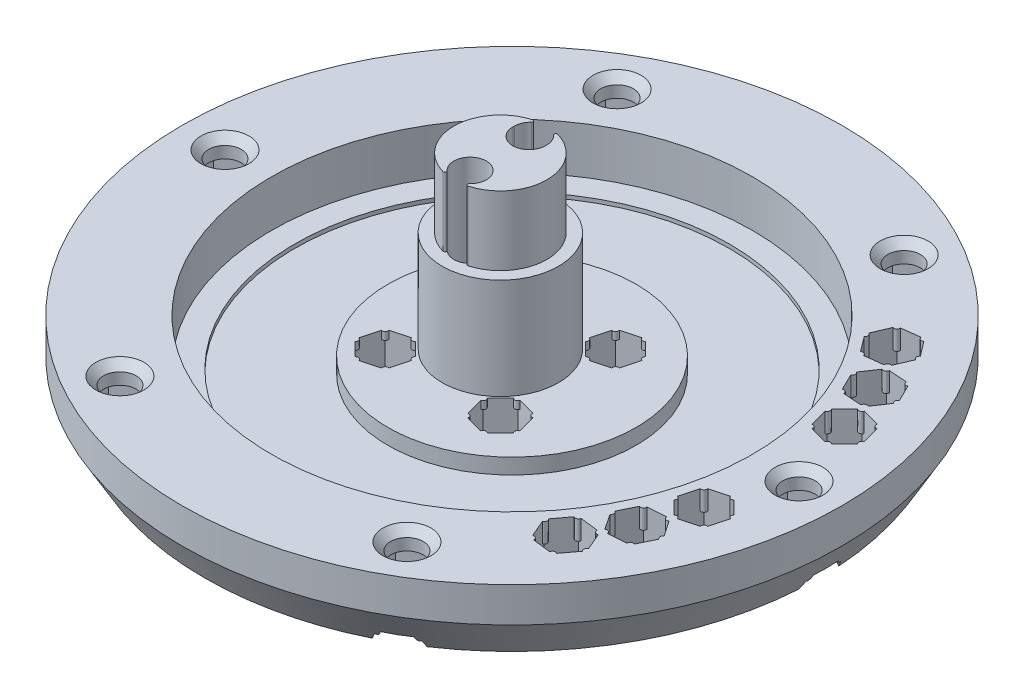
from build123d import *

# Parameters (mm, degrees)
SKETCH18_R              = 2.1
CUT_EXTRUDE11_DEPTH     = 79.825757212
CUT_EXTRUDE12_DEPTH     = 7
SKETCH20_R              = 0.4
BOSS_EXTRUDE1_DEPTH     = 2.5
CIRPATTERN1_COUNT       = 6
CHAMFER5_SIZE           = 1
SKETCH6_R               = 1.6
CUT_EXTRUDE1_DEPTH      = 76.686854869
CUT_EXTRUDE3_DEPTH      = 4.5
SKETCH17_R              = 3
CUT_EXTRUDE10_DEPTH     = 7
SKETCH28_R              = 0.4
BOSS_EXTRUDE4_DEPTH     = 1
CUT_EXTRUDE6_REACH      = 70.567
SKETCH12_R              = 2.1
CUT_EXTRUDE5_DEPTH      = 85.926438757
SPLIT1_SURFACE_1_BACK   = 135.35
SPLIT1_SURFACE_1_DEPTH  = 270.7
SPLIT1_SURFACE_2_BACK   = 135.35
SPLIT1_SURFACE_2_DEPTH  = 270.7
SKETCH14_R              = 3.7
CUT_EXTRUDE7_DEPTH      = 4
CUT_EXTRUDE16_DEPTH     = 83.149254409
MOVE_START              = 27
MOVE_FACE1_DEPTH        = 14.5
MOVE_START_2            = 26.9
MOVE_FACE2_DEPTH        = 0.1
CHAMFER1_SIZE           = 5
CHAMFER1_SIZE_2         = 2.886751346
CHAMFER2_SIZE           = 0.699461487
CHAMFER2_SIZE_2         = 1.5
CHAMFER3_SIZE           = 1
CHAMFER3_SIZE_2         = 0.577350269
CUT_EXTRUDE8_DEPTH      = 13
SKETCH26_R              = 0.3
BOSS_EXTRUDE3_DEPTH     = 8.5
SKETCH21_R              = 1.6
CUT_EXTRUDE13_DEPTH     = 79.825757384
CUT_EXTRUDE14_DEPTH     = 5.5
SKETCH23_R              = 0.4
BOSS_EXTRUDE2_DEPTH     = 2.5
SKETCH24_R              = 3
CUT_EXTRUDE15_DEPTH     = 3
CIRPATTERN2_COUNT       = 3
CIRPATTERN2_ANGLE       = 22
MIRROR1_COPY_1_SKETCH_R = 1.6
MIRROR1_COPY_1_DEPTH    = 79.825757384
MIRROR1_COPY_2_SKETCH_R = 1.6
MIRROR1_COPY_2_DEPTH    = 79.825757384
MIRROR1_COPY_3_DEPTH    = 5.5
MIRROR1_COPY_4_DEPTH    = 5.5
MIRROR1_COPY_5_SKETCH_R = 0.4
MIRROR1_COPY_5_DEPTH    = 2.5
MIRROR1_COPY_6_SKETCH_R = 0.4
MIRROR1_COPY_6_DEPTH    = 2.5
MIRROR1_COPY_7_SKETCH_R = 3
MIRROR1_COPY_7_DEPTH    = 3
MIRROR1_COPY_8_SKETCH_R = 3
MIRROR1_COPY_8_DEPTH    = 3
CUT_EXTRUDE17_DEPTH     = 5
BOSS_EXTRUDE5_START     = 0.5
SKETCH30_R              = 2
BOSS_EXTRUDE5_DEPTH     = 4.5
SKETCH16_R              = 3.16
CUT_EXTRUDE9_DEPTH      = 3.3


# Read off the part's stored shape, not the designer's step: Move Face1, Move Face2
with BuildPart() as part:
    # Sketch1 → Revolve1 (revolve)
    with BuildSketch(Plane.XY, mode=Mode.PRIVATE) as revolve1_sk:
        Polygon((0, 0), (-42.5, 0), (-42.5, 9.5), (-31, 9.5), (-31, 3.5), (-28, 3.5), (-28, 3), (-16, 3), (-16, 5), (0, 5), align=None)
    revolve(revolve1_sk.sketch.rotate(Axis((0, 0, 0), (0, 1, 0)), 270), axis=Axis((0, 0, 0), (0, 1, 0)))

    # Sketch2 → Revolve2 (revolve)
    with BuildSketch(Plane.XY, mode=Mode.PRIVATE) as revolve2_sk:
        Polygon((0, -9), (-15, -9), (-15, -1), (-18, -1), (-18, 0), (0, 0), align=None)
        Polygon((0, 51), (-8.5, 51), (-8.5, 43), (-10.5, 43), (-10.5, 41.5), (0, 41.5), align=None)
    revolve(revolve2_sk.sketch.rotate(Axis((0, 0, 0), (0, 1, 0)), 270), axis=Axis((0, 0, 0), (0, 1, 0)))


with BuildPart() as revolve2_piece_1:
    # of the separate pieces the step leaves, piece 1, a body of its own (revolve2_pieces)
    add(part.part.solids().sort_by_distance((0, 0, -42.5))[0])



with BuildPart() as revolve2_piece_2:
    # of the separate pieces the step leaves, piece 2, a body of its own (revolve2_pieces)
    add(part.part.solids().sort_by_distance((0, 51, -8.5))[0])


with BuildPart() as revolve2_piece_1_1:
    add(revolve2_piece_1.part)

    add(revolve2_piece_2.part)  # Revolve3 merges Revolve2 piece 2
    # Sketch3 → Revolve3 (revolve)
    with BuildSketch(Plane.XY):
        Polygon((-1.5, 5), (-9, 5), (-9, 18), (-7.5, 18), (-7.5, 40.5), (-9, 40.5), (-9, 43), (-7.5, 43), (-1.5, 43), align=None)
    revolve(axis=Axis((-1.5, 57.896768885, 0), (0, -1, 0)))

    # Sketch18 → Cut-Extrude11 (cut, through all)
    with BuildSketch(Plane.XZ):
        with Locations(Location((-37, 0, 0), (0, 0, 270))):
            Circle(SKETCH18_R)
        with Locations(Location((-18.5, 32.04293994, 0), (0, 0, 270))):
            Circle(SKETCH18_R)
        with Locations(Location((18.5, 32.04293994, 0), (0, 0, 270))):
            Circle(SKETCH18_R)
        with Locations(Location((37, 0, 0), (0, 0, 270))):
            Circle(SKETCH18_R)
        with Locations(Location((18.5, -32.04293994, 0), (0, 0, 270))):
            Circle(SKETCH18_R)
        with Locations(Location((-18.5, -32.04293994, 0), (0, 0, 270))):
            Circle(SKETCH18_R)
    extrude(amount=-CUT_EXTRUDE11_DEPTH, mode=Mode.SUBTRACT)

    # Sketch19 → Cut-Extrude12 (cut)
    with BuildSketch(Plane.XZ):
        Polygon((-33.5, -2.020725942), (-33.5, 2.020725942), (-37, 4.041451884), (-40.5, 2.020725942), (-40.5, -2.020725942), (-37, -4.041451884), align=None)
    cut_extrude12 = extrude(amount=-CUT_EXTRUDE12_DEPTH, mode=Mode.SUBTRACT)

    # Sketch20 → Boss-Extrude1 (add)
    with BuildSketch(Plane.XZ):
        with Locations((-40.5, 2.020725942)):
            Circle(SKETCH20_R)
        with Locations((-37, 4.041451884)):
            Circle(SKETCH20_R)
        with Locations((-33.5, 2.020725942)):
            Circle(SKETCH20_R)
        with Locations((-33.5, -2.020725942)):
            Circle(SKETCH20_R)
        with Locations((-37, -4.041451884)):
            Circle(SKETCH20_R)
        with Locations((-40.5, -2.020725942)):
            Circle(SKETCH20_R)
    boss_extrude1 = extrude(amount=-BOSS_EXTRUDE1_DEPTH)

    # CirPattern1: Cut-Extrude12, Boss-Extrude1 ×6 about axis
    cirpattern1_axis = Axis((0, 0, 0), (0, 1, 0))
    add([cut_extrude12.rotate(cirpattern1_axis, i * 360 / CIRPATTERN1_COUNT) for i in range(1, CIRPATTERN1_COUNT)], mode=Mode.SUBTRACT)
    add([boss_extrude1.rotate(cirpattern1_axis, i * 360 / CIRPATTERN1_COUNT) for i in range(1, CIRPATTERN1_COUNT)])

    # Chamfer5
    chamfer5_edges = [revolve2_piece_1_1.edges().sort_by_distance(p)[0] for p in [
        (-37, 9.5, 2.1),
        (-18.5, 9.5, -29.94293994),
        (18.5, 9.5, -29.94293994),
        (37, 9.5, 2.1),
        (18.5, 9.5, 34.14293994),
        (-18.5, 9.5, 34.14293994),
    ]]
    chamfer(chamfer5_edges, length=CHAMFER5_SIZE)

    # Sketch6 → Cut-Extrude1 (cut, through all)
    with BuildSketch(Plane(origin=(0, 5, 0), x_dir=(1, 0, 0), z_dir=(0, 1, 0))):
        with Locations(Location((5.924621202, 7.424621202, 0), (0, 0, 270))):
            Circle(SKETCH6_R)
        with Locations(Location((5.924621202, -7.424621202, 0), (0, 0, 270))):
            Circle(SKETCH6_R)
        with Locations(Location((-8.924621202, -7.424621202, 0), (0, 0, 270))):
            Circle(SKETCH6_R)
        with Locations(Location((-8.924621202, 7.424621202, 0), (0, 0, 270))):
            Circle(SKETCH6_R)
    extrude(amount=-CUT_EXTRUDE1_DEPTH, mode=Mode.SUBTRACT)

    # Sketch10 → Cut-Extrude3 (cut)
    with BuildSketch(Plane(origin=(0, 5, 0), x_dir=(1, 0, 0), z_dir=(0, 1, 0))):
        Polygon((6.746482052, 10.491847649), (3.679255605, 9.6699868), (2.857394755, 6.602760353), (5.102760353, 4.357394755), (8.1699868, 5.179255605), (8.991847649, 8.246482052), align=None)
        Polygon((8.991847649, -8.246482052), (8.1699868, -5.179255605), (5.102760353, -4.357394755), (2.857394755, -6.602760353), (3.679255605, -9.6699868), (6.746482052, -10.491847649), align=None)
        Polygon((-9.746482052, -10.491847649), (-6.679255605, -9.6699868), (-5.857394755, -6.602760353), (-8.102760353, -4.357394755), (-11.1699868, -5.179255605), (-11.991847649, -8.246482052), align=None)
        Polygon((-11.991847649, 8.246482052), (-11.1699868, 5.179255605), (-8.102760353, 4.357394755), (-5.857394755, 6.602760353), (-6.679255605, 9.6699868), (-9.746482052, 10.491847649), align=None)
    extrude(amount=-CUT_EXTRUDE3_DEPTH, mode=Mode.SUBTRACT)

    # Sketch17 → Cut-Extrude10 (cut)
    with BuildSketch(Plane.XZ.offset(9)):
        with Locations(Location((5.924621202, -7.424621202, 0), (0, 0, 270))):
            Circle(SKETCH17_R)
        with Locations(Location((-8.924621202, -7.424621202, 0), (0, 0, 270))):
            Circle(SKETCH17_R)
        with Locations(Location((-8.924621202, 7.424621202, 0), (0, 0, 270))):
            Circle(SKETCH17_R)
        with Locations(Location((5.924621202, 7.424621202, 0), (0, 0, 270))):
            Circle(SKETCH17_R)
    extrude(amount=-CUT_EXTRUDE10_DEPTH, mode=Mode.SUBTRACT)

    # Sketch28 → Boss-Extrude4 (add)
    with BuildSketch(Plane(origin=(0, 5, 0), x_dir=(1, 0, 0), z_dir=(0, 1, 0))):
        with Locations((-6.679255605, 9.6699868)):
            Circle(SKETCH28_R)
        with Locations((-5.857394755, 6.602760353)):
            Circle(SKETCH28_R)
        with Locations((-8.102760353, 4.357394755)):
            Circle(SKETCH28_R)
        with Locations((-11.1699868, 5.179255605)):
            Circle(SKETCH28_R)
        with Locations((-11.991847649, 8.246482052)):
            Circle(SKETCH28_R)
        with Locations((-9.746482052, 10.491847649)):
            Circle(SKETCH28_R)
        with Locations((8.1699868, 5.179255605)):
            Circle(SKETCH28_R)
        with Locations((5.102760353, 4.357394755)):
            Circle(SKETCH28_R)
        with Locations((2.857394755, 6.602760353)):
            Circle(SKETCH28_R)
        with Locations((3.679255605, 9.6699868)):
            Circle(SKETCH28_R)
        with Locations((6.746482052, 10.491847649)):
            Circle(SKETCH28_R)
        with Locations((8.991847649, 8.246482052)):
            Circle(SKETCH28_R)
        with Locations((3.679255605, -9.6699868)):
            Circle(SKETCH28_R)
        with Locations((2.857394755, -6.602760353)):
            Circle(SKETCH28_R)
        with Locations((5.102760353, -4.357394755)):
            Circle(SKETCH28_R)
        with Locations((8.1699868, -5.179255605)):
            Circle(SKETCH28_R)
        with Locations((8.991847649, -8.246482052)):
            Circle(SKETCH28_R)
        with Locations((6.746482052, -10.491847649)):
            Circle(SKETCH28_R)
        with Locations((-11.1699868, -5.179255605)):
            Circle(SKETCH28_R)
        with Locations((-8.102760353, -4.357394755)):
            Circle(SKETCH28_R)
        with Locations((-5.857394755, -6.602760353)):
            Circle(SKETCH28_R)
        with Locations((-6.679255605, -9.6699868)):
            Circle(SKETCH28_R)
        with Locations((-9.746482052, -10.491847649)):
            Circle(SKETCH28_R)
        with Locations((-11.991847649, -8.246482052)):
            Circle(SKETCH28_R)
    extrude(amount=-BOSS_EXTRUDE4_DEPTH)

    # Cut-Extrude6: up to this face of the body (flat: up to its plane)
    cut_extrude6_end = Plane(revolve2_piece_1_1.part.faces().sort_by_distance((0, 41.5, 10.203015152))[0])
    # Sketch13 → Cut-Extrude6 (cut, up to the picked face)
    with BuildSketch(Plane(origin=(0, 18, 0), x_dir=(1, 0, 0), z_dir=(0, 1, 0)), mode=Mode.PRIVATE) as cut_extrude6_sk1:
        with BuildLine():
            Line((-2.929743003, 5.43812709), (-0.070256997, 5.43812709))
            ThreePointArc((-0.070256997, 5.43812709), (-0.108528873, 5.682449056), (0.119905865, 5.777188329))
            ThreePointArc((0.119905865, 5.777188329), (-1.5, 6), (-3.119905865, 5.777188329))
            ThreePointArc((-3.119905865, 5.777188329), (-2.891471127, 5.682449056), (-2.929743003, 5.43812709))
        make_face()
    cut_extrude6_tool1 = split(extrude(cut_extrude6_sk1.sketch, amount=CUT_EXTRUDE6_REACH, mode=Mode.PRIVATE), bisect_by=cut_extrude6_end, keep=Keep.BOTH, mode=Mode.PRIVATE)
    # Sketch13 → Cut-Extrude6 (cut, up to the picked face)
    with BuildSketch(Plane(origin=(0, 18, 0), x_dir=(1, 0, 0), z_dir=(0, 1, 0)), mode=Mode.PRIVATE) as cut_extrude6_sk2:
        with BuildLine():
            Line((-2.929743003, -5.43812709), (-0.070256997, -5.43812709))
            ThreePointArc((-0.070256997, -5.43812709), (-0.108528873, -5.682449056), (0.119905865, -5.777188329))
            ThreePointArc((0.119905865, -5.777188329), (-1.5, -6), (-3.119905865, -5.777188329))
            ThreePointArc((-3.119905865, -5.777188329), (-2.891471127, -5.682449056), (-2.929743003, -5.43812709))
        make_face()
    cut_extrude6_tool2 = split(extrude(cut_extrude6_sk2.sketch, amount=CUT_EXTRUDE6_REACH, mode=Mode.PRIVATE), bisect_by=cut_extrude6_end, keep=Keep.BOTH, mode=Mode.PRIVATE)
    add(cut_extrude6_tool1.solids().sort_by(Axis((-1.5, 18, -5.69578), (0, 1, 0)))[0], mode=Mode.SUBTRACT)
    add(cut_extrude6_tool2.solids().sort_by(Axis((-1.5, 18, 5.69578), (0, 1, 0)))[0], mode=Mode.SUBTRACT)

    # Sketch12 → Cut-Extrude5 (cut, through all)
    with BuildSketch(Plane(origin=(0, 51, 0), x_dir=(1, 0, 0), z_dir=(0, 1, 0))):
        with Locations(Location((-1.5, -3.9, 0), (0, 0, 90))):
            Circle(SKETCH12_R)
        with BuildLine():
            Line((0.6, 3.9), (0.6, 3.7))
            ThreePointArc((0.6, 3.7), (-1.5, 1.6), (-3.6, 3.7))
            Line((-3.6, 3.7), (-3.6, 3.9))
            ThreePointArc((-3.6, 3.9), (-1.5, 6), (0.6, 3.9))
        make_face()
    extrude(amount=-CUT_EXTRUDE5_DEPTH, mode=Mode.SUBTRACT)


with BuildPart() as body_2:
    # Split1: the piece behind the surface
    add(revolve2_piece_1_1.part)
    # Split1 surface: a surface, the sketch's curves swept straight by 270.7 mm
    with BuildLine(Plane.ZY.offset(-SPLIT1_SURFACE_1_BACK), mode=Mode.PRIVATE) as split1_surface_1_path:
        Line((-8.5, 27), (-2, 27))
        Line((-2, 27), (2, 27))
        Line((2, 27), (8.5, 27))
    split1_surface_1 = Shell.extrude(split1_surface_1_path.wire(), (-1 * SPLIT1_SURFACE_1_DEPTH, 0 * SPLIT1_SURFACE_1_DEPTH, 0 * SPLIT1_SURFACE_1_DEPTH))
    split(bisect_by=split1_surface_1, keep=Keep.BOTTOM)

    # Move Face2 outline → Move Face2 (cut)
    with BuildSketch(Plane(origin=(0, 0, 0), x_dir=(1, 0, 0), z_dir=(0, 1, 0)).offset(MOVE_START_2)):
        with BuildLine():
            ThreePointArc((-2.929743003, 5.43812709), (-2.891471127, 5.682449056), (-3.119905865, 5.777188329))
            ThreePointArc((-3.119905865, 5.777188329), (-7.5, 0), (-3.119905865, -5.777188329))
            ThreePointArc((-3.119905865, -5.777188329), (-2.891471127, -5.682449056), (-2.929743003, -5.43812709))
            ThreePointArc((-2.929743003, -5.43812709), (-1.5, -1.8), (-0.070256997, -5.43812709))
            ThreePointArc((-0.070256997, -5.43812709), (-0.108528873, -5.682449056), (0.119905865, -5.777188329))
            ThreePointArc((0.119905865, -5.777188329), (4.5, 0), (0.119905865, 5.777188329))
            ThreePointArc((0.119905865, 5.777188329), (-0.108528873, 5.682449056), (-0.070256997, 5.43812709))
            ThreePointArc((-0.070256997, 5.43812709), (0.425157176, 4.738909916), (0.6, 3.9))
            Line((0.6, 3.9), (0.6, 3.7))
            ThreePointArc((0.6, 3.7), (-1.5, 1.6), (-3.6, 3.7))
            Line((-3.6, 3.7), (-3.6, 3.9))
            ThreePointArc((-3.6, 3.9), (-3.425157176, 4.738909916), (-2.929743003, 5.43812709))
        make_face()
    extrude(amount=MOVE_FACE2_DEPTH, mode=Mode.SUBTRACT)

    # Chamfer1
    # the kernel refuses this chamfer: 5, 2.886751346 mm, written as the material it takes off along each edge
    with BuildSketch(Plane(origin=(0, 0, 0), x_dir=(0, 0, -1), z_dir=(1, 0, 0))) as chamfer1_piece_1:
        Polygon((42.5, CHAMFER1_SIZE), (42.5 - CHAMFER1_SIZE_2, 0), (42.5, 0), align=None)
    revolve(axis=Axis((0, 0, 0), (0, 1, 0)), mode=Mode.SUBTRACT)

    # Chamfer3
    # the kernel refuses this chamfer: 1, 0.577350269 mm, written as the material it takes off along each edge
    with BuildSketch(Plane(origin=(0, -9, 0), x_dir=(0, 0, -1), z_dir=(1, 0, 0))) as chamfer3_piece_1:
        Polygon((15, CHAMFER3_SIZE), (15 - CHAMFER3_SIZE_2, 0), (15, 0), align=None)
    revolve(axis=Axis((0, -9, 0), (0, 1, 0)), mode=Mode.SUBTRACT)

    # Sketch15 → Cut-Extrude8 (cut)
    with BuildSketch(Plane.XZ.offset(9)):
        Polygon((2.512584371, 3.9), (0.506292185, 7.375), (-3.506292185, 7.375), (-5.512584371, 3.9), (-3.506292185, 0.425), (0.506292185, 0.425), align=None)
        Polygon((0.506292185, -7.375), (2.512584371, -3.9), (0.506292185, -0.425), (-3.506292185, -0.425), (-5.512584371, -3.9), (-3.506292185, -7.375), align=None)
    extrude(amount=-CUT_EXTRUDE8_DEPTH, mode=Mode.SUBTRACT)

    # Sketch26 → Boss-Extrude3 (add)
    with BuildSketch(Plane.XZ.offset(9)):
        with Locations((-3.506292185, 7.375)):
            Circle(SKETCH26_R)
        with Locations((-5.512584371, 3.9)):
            Circle(SKETCH26_R)
        with Locations((-3.506292185, 0.425)):
            Circle(SKETCH26_R)
        with Locations((0.506292185, 7.375)):
            Circle(SKETCH26_R)
        with Locations((2.512584371, 3.9)):
            Circle(SKETCH26_R)
        with Locations((2.512584371, -3.9)):
            Circle(SKETCH26_R)
        with Locations((0.506292185, -7.375)):
            Circle(SKETCH26_R)
        with Locations((-3.506292185, -0.425)):
            Circle(SKETCH26_R)
        with Locations((-5.512584371, -3.9)):
            Circle(SKETCH26_R)
        with Locations((-3.506292185, -7.375)):
            Circle(SKETCH26_R)
        with Locations((0.506292185, 0.425)):
            Circle(SKETCH26_R)
        with Locations((0.506292185, -0.425)):
            Circle(SKETCH26_R)
    extrude(amount=-BOSS_EXTRUDE3_DEPTH)

    # Sketch21 → Cut-Extrude13 (cut, through all)
    with BuildSketch(Plane.XZ):
        with Locations(Location((33.80740392, 9.058666579, 0), (0, 0, 270))):
            Circle(SKETCH21_R)
    cut_extrude13 = extrude(amount=-CUT_EXTRUDE13_DEPTH, mode=Mode.SUBTRACT)

    # Sketch22 → Cut-Extrude14 (cut)
    with BuildSketch(Plane(origin=(0, 9.5, 0), x_dir=(1, 0, 0), z_dir=(0, 1, 0))):
        Polygon((36.874630367, -8.236805729), (34.62926477, -5.991440132), (31.562038323, -6.813300981), (30.740177473, -9.880527428), (32.985543071, -12.125893026), (36.052769518, -11.304032176), align=None)
    cut_extrude14 = extrude(amount=-CUT_EXTRUDE14_DEPTH, mode=Mode.SUBTRACT)

    # Sketch23 → Boss-Extrude2 (add)
    with BuildSketch(Plane(origin=(0, 9.5, 0), x_dir=(1, 0, 0), z_dir=(0, 1, 0))):
        with Locations((31.562038323, -6.813300981)):
            Circle(SKETCH23_R)
        with Locations((34.62926477, -5.991440132)):
            Circle(SKETCH23_R)
        with Locations((36.874630367, -8.236805729)):
            Circle(SKETCH23_R)
        with Locations((36.052769518, -11.304032176)):
            Circle(SKETCH23_R)
        with Locations((32.985543071, -12.125893026)):
            Circle(SKETCH23_R)
        with Locations((30.740177473, -9.880527428)):
            Circle(SKETCH23_R)
    boss_extrude2 = extrude(amount=-BOSS_EXTRUDE2_DEPTH)

    # Sketch24 → Cut-Extrude15 (cut)
    with BuildSketch(Plane.XZ):
        with Locations(Location((33.80740392, 9.058666579, 0), (0, 0, 270))):
            Circle(SKETCH24_R)
    cut_extrude15 = extrude(amount=-CUT_EXTRUDE15_DEPTH, mode=Mode.SUBTRACT)

    # CirPattern2: Cut-Extrude13, Cut-Extrude14, Boss-Extrude2, Cut-Extrude15 ×3 about axis
    cirpattern2_axis = Axis((0, 0, 0), (0, -1, 0))
    add([cut_extrude13.rotate(cirpattern2_axis, i * CIRPATTERN2_ANGLE / (CIRPATTERN2_COUNT - 1)) for i in range(1, CIRPATTERN2_COUNT)], mode=Mode.SUBTRACT)
    add([cut_extrude14.rotate(cirpattern2_axis, i * CIRPATTERN2_ANGLE / (CIRPATTERN2_COUNT - 1)) for i in range(1, CIRPATTERN2_COUNT)], mode=Mode.SUBTRACT)
    add([boss_extrude2.rotate(cirpattern2_axis, i * CIRPATTERN2_ANGLE / (CIRPATTERN2_COUNT - 1)) for i in range(1, CIRPATTERN2_COUNT)])
    add([cut_extrude15.rotate(cirpattern2_axis, i * CIRPATTERN2_ANGLE / (CIRPATTERN2_COUNT - 1)) for i in range(1, CIRPATTERN2_COUNT)], mode=Mode.SUBTRACT)

    # Mirror1: Cut-Extrude13, Cut-Extrude14, Boss-Extrude2, Cut-Extrude15 across plane
    add(cut_extrude13.mirror(Plane.XY), mode=Mode.SUBTRACT)
    add(cut_extrude14.mirror(Plane.XY), mode=Mode.SUBTRACT)
    add(boss_extrude2.mirror(Plane.XY))
    add(cut_extrude15.mirror(Plane.XY), mode=Mode.SUBTRACT)

    # Mirror1 copy 1 sketch → Mirror1 copy 1 (cut, through all)
    with BuildSketch(Plane(origin=(0, 0, 0), x_dir=(0.9816271834476639, 0, -0.19080899537654528), z_dir=(0, -1, 0))):
        with Locations((33.80740392, -9.058666579)):
            Circle(MIRROR1_COPY_1_SKETCH_R)
    extrude(amount=-MIRROR1_COPY_1_DEPTH, mode=Mode.SUBTRACT)

    # Mirror1 copy 2 sketch → Mirror1 copy 2 (cut, through all)
    with BuildSketch(Plane(origin=(0, 0, 0), x_dir=(0.9271838545667871, 0, -0.3746065934159129), z_dir=(0, -1, 0))):
        with Locations((33.80740392, -9.058666579)):
            Circle(MIRROR1_COPY_2_SKETCH_R)
    extrude(amount=-MIRROR1_COPY_2_DEPTH, mode=Mode.SUBTRACT)

    # Mirror1 copy 3 sketch → Mirror1 copy 3 (cut)
    with BuildSketch(Plane(origin=(0, 9.5, 0), x_dir=(0.9816271834476639, 0, -0.19080899537654528), z_dir=(0, 1, 0))):
        Polygon((36.874630367, 8.236805729), (34.62926477, 5.991440132), (31.562038323, 6.813300981), (30.740177473, 9.880527428), (32.985543071, 12.125893026), (36.052769518, 11.304032176), align=None)
    extrude(amount=-MIRROR1_COPY_3_DEPTH, mode=Mode.SUBTRACT)

    # Mirror1 copy 4 sketch → Mirror1 copy 4 (cut)
    with BuildSketch(Plane(origin=(0, 9.5, 0), x_dir=(0.9271838545667871, 0, -0.3746065934159129), z_dir=(0, 1, 0))):
        Polygon((36.874630367, 8.236805729), (34.62926477, 5.991440132), (31.562038323, 6.813300981), (30.740177473, 9.880527428), (32.985543071, 12.125893026), (36.052769518, 11.304032176), align=None)
    extrude(amount=-MIRROR1_COPY_4_DEPTH, mode=Mode.SUBTRACT)

    # Mirror1 copy 5 sketch → Mirror1 copy 5 (add)
    with BuildSketch(Plane(origin=(0, 9.5, 0), x_dir=(0.9816271834476639, 0, -0.19080899537654528), z_dir=(0, 1, 0))):
        with Locations((31.562038323, 6.813300981)):
            Circle(MIRROR1_COPY_5_SKETCH_R)
        with Locations((34.62926477, 5.991440132)):
            Circle(MIRROR1_COPY_5_SKETCH_R)
        with Locations((36.874630367, 8.236805729)):
            Circle(MIRROR1_COPY_5_SKETCH_R)
        with Locations((36.052769518, 11.304032176)):
            Circle(MIRROR1_COPY_5_SKETCH_R)
        with Locations((32.985543071, 12.125893026)):
            Circle(MIRROR1_COPY_5_SKETCH_R)
        with Locations((30.740177473, 9.880527428)):
            Circle(MIRROR1_COPY_5_SKETCH_R)
    extrude(amount=-MIRROR1_COPY_5_DEPTH)

    # Mirror1 copy 6 sketch → Mirror1 copy 6 (add)
    with BuildSketch(Plane(origin=(0, 9.5, 0), x_dir=(0.9271838545667871, 0, -0.3746065934159129), z_dir=(0, 1, 0))):
        with Locations((31.562038323, 6.813300981)):
            Circle(MIRROR1_COPY_6_SKETCH_R)
        with Locations((34.62926477, 5.991440132)):
            Circle(MIRROR1_COPY_6_SKETCH_R)
        with Locations((36.874630367, 8.236805729)):
            Circle(MIRROR1_COPY_6_SKETCH_R)
        with Locations((36.052769518, 11.304032176)):
            Circle(MIRROR1_COPY_6_SKETCH_R)
        with Locations((32.985543071, 12.125893026)):
            Circle(MIRROR1_COPY_6_SKETCH_R)
        with Locations((30.740177473, 9.880527428)):
            Circle(MIRROR1_COPY_6_SKETCH_R)
    extrude(amount=-MIRROR1_COPY_6_DEPTH)

    # Mirror1 copy 7 sketch → Mirror1 copy 7 (cut)
    with BuildSketch(Plane(origin=(0, 0, 0), x_dir=(0.9816271834476639, 0, -0.19080899537654528), z_dir=(0, -1, 0))):
        with Locations((33.80740392, -9.058666579)):
            Circle(MIRROR1_COPY_7_SKETCH_R)
    extrude(amount=-MIRROR1_COPY_7_DEPTH, mode=Mode.SUBTRACT)

    # Mirror1 copy 8 sketch → Mirror1 copy 8 (cut)
    with BuildSketch(Plane(origin=(0, 0, 0), x_dir=(0.9271838545667871, 0, -0.3746065934159129), z_dir=(0, -1, 0))):
        with Locations((33.80740392, -9.058666579)):
            Circle(MIRROR1_COPY_8_SKETCH_R)
    extrude(amount=-MIRROR1_COPY_8_DEPTH, mode=Mode.SUBTRACT)

    # Sketch29 → Cut-Extrude17 (cut)
    with BuildSketch(Plane.XZ.offset(9)):
        with BuildLine():
            Line((-2.25, 7.375), (2.25, 7.375))
            Line((2.25, 7.375), (2.25, 5.562148865))
            ThreePointArc((2.25, 5.562148865), (4.242640687, 4.242640687), (5.562148865, 2.25))
            Line((5.562148865, 2.25), (7.375, 2.25))
            Line((7.375, 2.25), (7.375, -2.25))
            Line((7.375, -2.25), (5.562148865, -2.25))
            ThreePointArc((5.562148865, -2.25), (4.242640687, -4.242640687), (2.25, -5.562148865))
            Line((2.25, -5.562148865), (2.25, -7.375))
            Line((2.25, -7.375), (-2.25, -7.375))
            Line((-2.25, -7.375), (-2.25, -5.562148865))
            ThreePointArc((-2.25, -5.562148865), (-4.242640687, -4.242640687), (-5.562148865, -2.25))
            Line((-5.562148865, -2.25), (-7.375, -2.25))
            Line((-7.375, -2.25), (-7.375, 2.25))
            Line((-7.375, 2.25), (-5.562148865, 2.25))
            ThreePointArc((-5.562148865, 2.25), (-4.242640687, 4.242640687), (-2.25, 5.562148865))
            Line((-2.25, 5.562148865), (-2.25, 7.375))
        make_face()
    extrude(amount=-CUT_EXTRUDE17_DEPTH, mode=Mode.SUBTRACT)


with BuildPart() as revolve2_piece_1_2:
    add(revolve2_piece_1_1.part)

    # Split1: split by a surface, the side it looks to stays
    # Split1 surface: a surface, the sketch's curves swept straight by 270.7 mm
    with BuildLine(Plane.ZY.offset(-SPLIT1_SURFACE_2_BACK), mode=Mode.PRIVATE) as split1_surface_2_path:
        Line((-8.5, 27), (-2, 27))
        Line((-2, 27), (2, 27))
        Line((2, 27), (8.5, 27))
    split1_surface_2 = Shell.extrude(split1_surface_2_path.wire(), (-1 * SPLIT1_SURFACE_2_DEPTH, 0 * SPLIT1_SURFACE_2_DEPTH, 0 * SPLIT1_SURFACE_2_DEPTH))
    split(bisect_by=split1_surface_2, keep=Keep.TOP)

    # Sketch14 → Cut-Extrude7 (cut)
    with BuildSketch(Plane(origin=(0, 51, 0), x_dir=(1, 0, 0), z_dir=(0, 1, 0))):
        with Locations(Location((-1.5, -3.9, 0), (0, 0, 270))):
            Circle(SKETCH14_R)
        with BuildLine():
            Line((2.2, 3.9), (2.2, 3.7))
            ThreePointArc((2.2, 3.7), (-1.5, 0), (-5.2, 3.7))
            Line((-5.2, 3.7), (-5.2, 3.9))
            ThreePointArc((-5.2, 3.9), (-1.5, 7.6), (2.2, 3.9))
        make_face()
    extrude(amount=-CUT_EXTRUDE7_DEPTH, mode=Mode.SUBTRACT)

    # Sketch25 → Cut-Extrude16 (cut, through all)
    with BuildSketch(Plane(origin=(0, 47, 0), x_dir=(1, 0, 0), z_dir=(0, 1, 0))):
        with BuildLine():
            ThreePointArc((0.231652643, -0.630232558), (-1.5, -0.2), (-3.231652643, -0.630232558))
            ThreePointArc((-3.231652643, -0.630232558), (-2.91246118, -0.1), (-3.231652643, 0.430232558))
            ThreePointArc((-3.231652643, 0.430232558), (-1.5, 0), (0.231652643, 0.430232558))
            ThreePointArc((0.231652643, 0.430232558), (-0.08753882, -0.1), (0.231652643, -0.630232558))
        make_face()
    extrude(amount=CUT_EXTRUDE16_DEPTH, mode=Mode.SUBTRACT)

    # Move Face1 outline → Move Face1 (add)
    with BuildSketch(Plane(origin=(0, 0, 0), x_dir=(1, 0, 0), z_dir=(0, 1, 0)).offset(MOVE_START)):
        with BuildLine():
            ThreePointArc((-3.146904296, 5.873474801), (-7.6, 0), (-3.146904296, -5.873474801))
            ThreePointArc((-3.146904296, -5.873474801), (-2.88102876, -5.82087646), (-2.766049163, -5.575446065))
            ThreePointArc((-2.766049163, -5.575446065), (-2.849643648, -5.508869797), (-2.929743003, -5.43812709))
            ThreePointArc((-2.929743003, -5.43812709), (-2.891471127, -5.682449056), (-3.119905865, -5.777188329))
            ThreePointArc((-3.119905865, -5.777188329), (-7.5, 0), (-3.119905865, 5.777188329))
            ThreePointArc((-3.119905865, 5.777188329), (-2.891471127, 5.682449056), (-2.929743003, 5.43812709))
            ThreePointArc((-2.929743003, 5.43812709), (-2.849643648, 5.508869797), (-2.766049163, 5.575446065))
            ThreePointArc((-2.766049163, 5.575446065), (-2.88102876, 5.82087646), (-3.146904296, 5.873474801))
        make_face()
        with BuildLine():
            ThreePointArc((-0.233950837, 5.575446065), (-0.150356352, 5.508869797), (-0.070256997, 5.43812709))
            ThreePointArc((-0.070256997, 5.43812709), (-0.108528873, 5.682449056), (0.119905865, 5.777188329))
            ThreePointArc((0.119905865, 5.777188329), (4.5, 0), (0.119905865, -5.777188329))
            ThreePointArc((0.119905865, -5.777188329), (-0.108528873, -5.682449056), (-0.070256997, -5.43812709))
            ThreePointArc((-0.070256997, -5.43812709), (-0.150356352, -5.508869797), (-0.233950837, -5.575446065))
            ThreePointArc((-0.233950837, -5.575446065), (-0.11897124, -5.82087646), (0.146904296, -5.873474801))
            ThreePointArc((0.146904296, -5.873474801), (4.6, 0), (0.146904296, 5.873474801))
            ThreePointArc((0.146904296, 5.873474801), (-0.11897124, 5.82087646), (-0.233950837, 5.575446065))
        make_face()
    extrude(amount=MOVE_FACE1_DEPTH)

    # Chamfer2
    # the kernel refuses this chamfer: 1.5, 0.699461487 mm, written as the material it takes off along each edge
    with BuildSketch(Plane(origin=(0, 51, 0), x_dir=(0, 0, -1), z_dir=(1, 0, 0))) as chamfer2_piece_1:
        Polygon((8.5 - CHAMFER2_SIZE, 0), (8.5, -CHAMFER2_SIZE_2), (8.5, 0), align=None)
    revolve(axis=Axis((0, 51, 0), (0, 1, 0)), mode=Mode.SUBTRACT)


with BuildPart() as body_3:
    # Sketch30 → Boss-Extrude5 (new body)
    with BuildSketch(Plane.XZ.offset(4).offset(BOSS_EXTRUDE5_START)):
        with BuildLine():
            Line((2.2, 7.325), (-2.2, 7.325))
            Line((-2.2, 7.325), (-2.2, 5.528336097))
            ThreePointArc((-2.2, 5.528336097), (-4.207285348, 4.207285348), (-5.528336097, 2.2))
            Line((-5.528336097, 2.2), (-7.325, 2.2))
            Line((-7.325, 2.2), (-7.325, -2.2))
            Line((-7.325, -2.2), (-5.528336097, -2.2))
            ThreePointArc((-5.528336097, -2.2), (-4.207285348, -4.207285348), (-2.2, -5.528336097))
            Line((-2.2, -5.528336097), (-2.2, -7.325))
            Line((-2.2, -7.325), (2.2, -7.325))
            Line((2.2, -7.325), (2.2, -5.528336097))
            ThreePointArc((2.2, -5.528336097), (4.207285348, -4.207285348), (5.528336097, -2.2))
            Line((5.528336097, -2.2), (7.325, -2.2))
            Line((7.325, -2.2), (7.325, 2.2))
            Line((7.325, 2.2), (5.528336097, 2.2))
            ThreePointArc((5.528336097, 2.2), (4.207285348, 4.207285348), (2.2, 5.528336097))
            Line((2.2, 5.528336097), (2.2, 7.325))
        make_face()
        with Locations(Location((0, 0, 0), (0, 0, 90))):
            Circle(SKETCH30_R, mode=Mode.SUBTRACT)
    extrude(amount=BOSS_EXTRUDE5_DEPTH)

    # Sketch16 → Cut-Extrude9 (cut)
    with BuildSketch(Plane.XZ.offset(9)):
        with Locations(Location((0, 0, 0), (0, 0, 270))):
            Circle(SKETCH16_R)
    extrude(amount=-CUT_EXTRUDE9_DEPTH, mode=Mode.SUBTRACT)


solid = body_2.part
